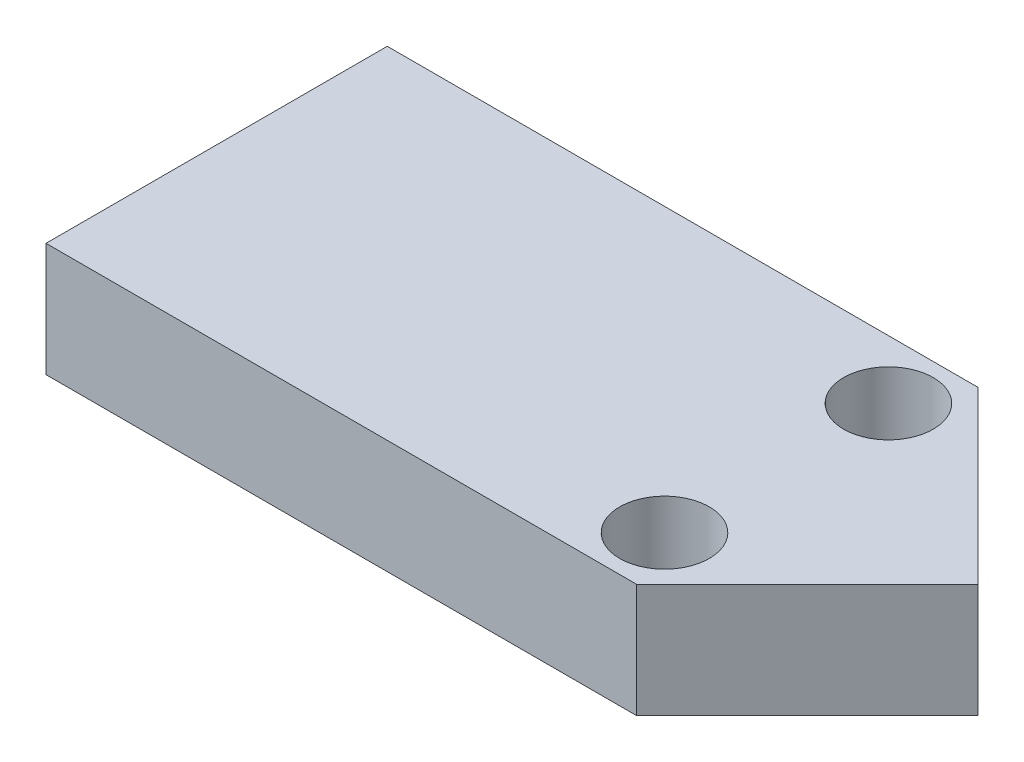
from build123d import *

# Parameters (mm, degrees)
BOSS_EXTRUDE1_DEPTH = 25.4
SKETCH2_R           = 10
CUT_EXTRUDE1_DEPTH  = 25.4


with BuildPart() as part:
    # Sketch1 → Boss-Extrude1 (new body)
    with BuildSketch(Plane(origin=(0, 0, 0), x_dir=(1, 0, 0), z_dir=(0, 1, 0))):
        Polygon((0, 76.2), (0, 0), (131.9, 0), (170, 38.1), (131.9, 76.2), align=None)
    extrude(amount=BOSS_EXTRUDE1_DEPTH)

    # Sketch2 → Cut-Extrude1 (cut)
    with BuildSketch(Plane(origin=(0, 25.4, 0), x_dir=(1, 0, 0), z_dir=(0, 1, 0))):
        with Locations((125, 63.1)):
            Circle(SKETCH2_R)
        with Locations((125, 13.1)):
            Circle(SKETCH2_R)
    extrude(amount=-CUT_EXTRUDE1_DEPTH, mode=Mode.SUBTRACT)


solid = part.part
